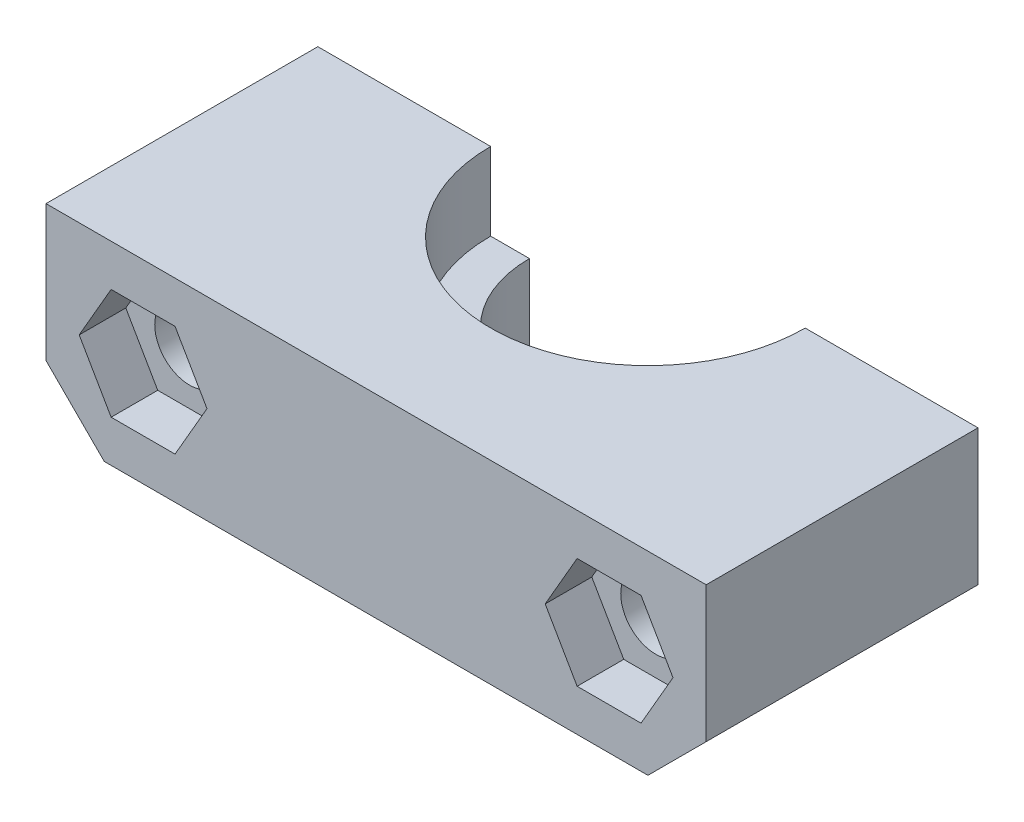
from build123d import *

# Parameters (mm, degrees)
SKETCH1_W               = 34
SKETCH1_H               = 14
BOSS_EXTRUDE1_DEPTH     = 10
SKETCH2_R               = 8.1
CUT_EXTRUDE1_DEPTH      = 4
CUT_EXTRUDE2_DEPTH      = 39.105117767
CUT_EXTRUDE2_DEPTH_BACK = 39.105117767
SKETCH4_R               = 6.1
CUT_EXTRUDE3_DEPTH      = 39.105117767
CUT_EXTRUDE3_DEPTH_BACK = 39.105117767
SKETCH5_R               = 1.8
CUT_EXTRUDE4_DEPTH      = 2.4
CHAMFER1_SIZE           = 3


with BuildPart() as part:
    # Sketch1 → Boss-Extrude1 (new body)
    with BuildSketch(Plane(origin=(0, 0, 0), x_dir=(1, 0, 0), z_dir=(0, 1, 0))):
        with Locations((17, 7)):
            Rectangle(SKETCH1_W, SKETCH1_H)
    extrude(amount=BOSS_EXTRUDE1_DEPTH)

    # Sketch2 → Cut-Extrude1 (cut)
    with BuildSketch(Plane(origin=(0, 10, 0), x_dir=(1, 0, 0), z_dir=(0, 1, 0))):
        with Locations((17, 14)):
            Circle(SKETCH2_R)
    extrude(amount=-CUT_EXTRUDE1_DEPTH, mode=Mode.SUBTRACT)

    # Sketch4 → Cut-Extrude2 (cut, two sides: drawn at the far end of the back side and taken through both)
    with BuildSketch(Plane(origin=(0, 10, 0), x_dir=(1, 0, 0), z_dir=(0, 1, 0)).offset(-CUT_EXTRUDE2_DEPTH_BACK)):
        with Locations((17, 14)):
            Circle(SKETCH4_R)
    extrude(amount=CUT_EXTRUDE2_DEPTH + CUT_EXTRUDE2_DEPTH_BACK, mode=Mode.SUBTRACT)

    # Sketch5 → Cut-Extrude3 (cut, two sides: drawn at the far end of the back side and taken through both)
    with BuildSketch(Plane(origin=(0, 0, -14), x_dir=(-1, 0, 0), z_dir=(0, 0, -1)).offset(-CUT_EXTRUDE3_DEPTH_BACK)):
        with Locations((-29, 5)):
            Circle(SKETCH5_R)
        with Locations((-5, 5)):
            Circle(SKETCH5_R)
    extrude(amount=CUT_EXTRUDE3_DEPTH + CUT_EXTRUDE3_DEPTH_BACK, mode=Mode.SUBTRACT)

    # Sketch6 → Cut-Extrude4 (cut)
    with BuildSketch(Plane.XY):
        Polygon((8.290896534, 5), (6.645448267, 7.85), (3.354551733, 7.85), (1.709103466, 5), (3.354551733, 2.15), (6.645448267, 2.15), align=None)
        Polygon((25.709103466, 5), (27.354551733, 2.15), (30.645448267, 2.15), (32.290896534, 5), (30.645448267, 7.85), (27.354551733, 7.85), align=None)
    extrude(amount=-CUT_EXTRUDE4_DEPTH, mode=Mode.SUBTRACT)

    # Chamfer1
    chamfer1_edges = [part.edges().sort_by_distance(p)[0] for p in [
        (0, 0, -7),
        (34, 0, -7),
    ]]
    chamfer(chamfer1_edges, length=CHAMFER1_SIZE)


solid = part.part
